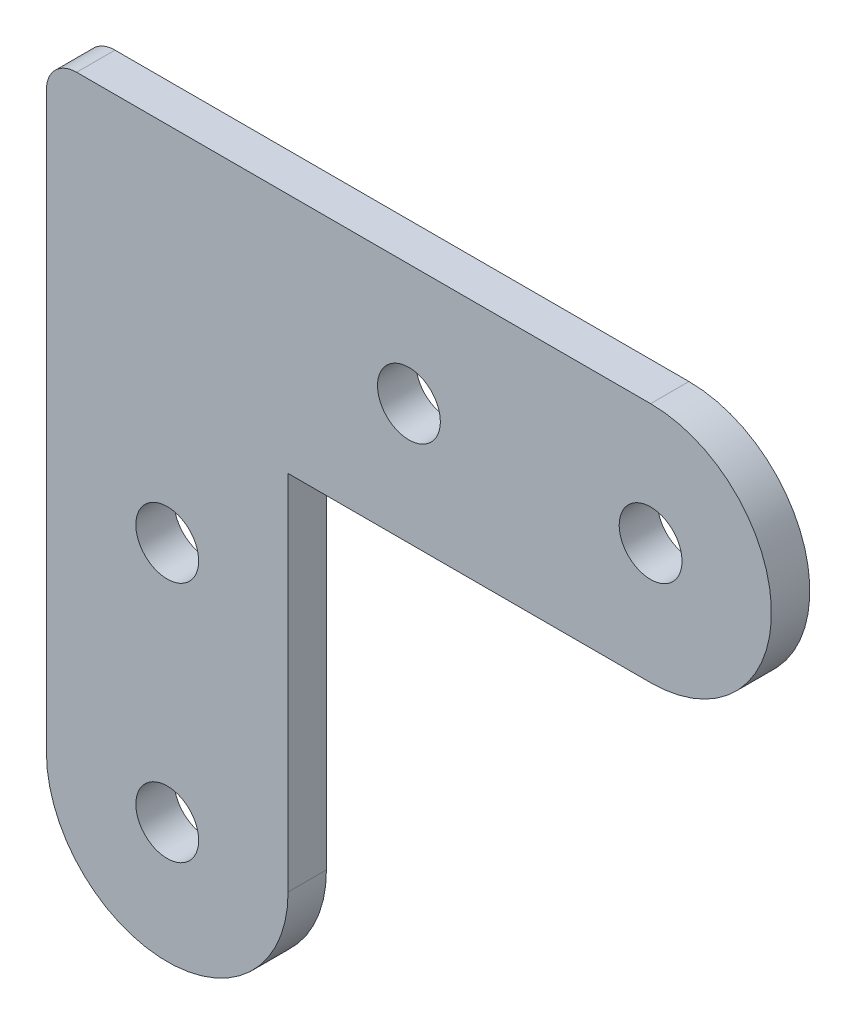
from build123d import *

# Parameters (mm, degrees)
BASE_FLANGE1_DEPTH         = 3.175
F_5_2_5_2_DIAMETER_HOLE1_D = 5.2


# Sheet-metal steps are written as plain solids
with BuildPart() as part:
    # Sketch11 → Base-Flange1 (new body)
    with BuildSketch(Plane(origin=(0, 0, -167.271453779), x_dir=(-1, 0, 0), z_dir=(0, 0, -1))):
        with BuildLine():
            Line((395.316058397, 315.309736729), (425.316058397, 315.309736729))
            Line((425.316058397, 315.309736729), (425.316058397, 285.309736729))
            ThreePointArc((425.316058397, 285.309736729), (435.316058397, 275.309736729), (445.316058397, 285.309736729))
            Line((445.316058397, 285.309736729), (445.316058397, 332.809736729))
            ThreePointArc((445.316058397, 332.809736729), (444.58382535, 334.577503682), (442.816058397, 335.309736729))
            Line((442.816058397, 335.309736729), (395.316058397, 335.309736729))
            ThreePointArc((395.316058397, 335.309736729), (385.316058397, 325.309736729), (395.316058397, 315.309736729))
        make_face()
    extrude(amount=-BASE_FLANGE1_DEPTH)

    # Ø5.2 (5.2) Diameter Hole1 (through all)
    with Locations(Plane(origin=(0, 0, -167.271453779), x_dir=(-1, 0, 0), z_dir=(0, 0, -1))):
        with Locations((435.316058397, 285.309736729), (395.316058397, 325.309736729), (415.316058397, 325.309736729), (435.316058397, 305.336856842)):
            Hole(F_5_2_5_2_DIAMETER_HOLE1_D / 2)


solid = part.part
